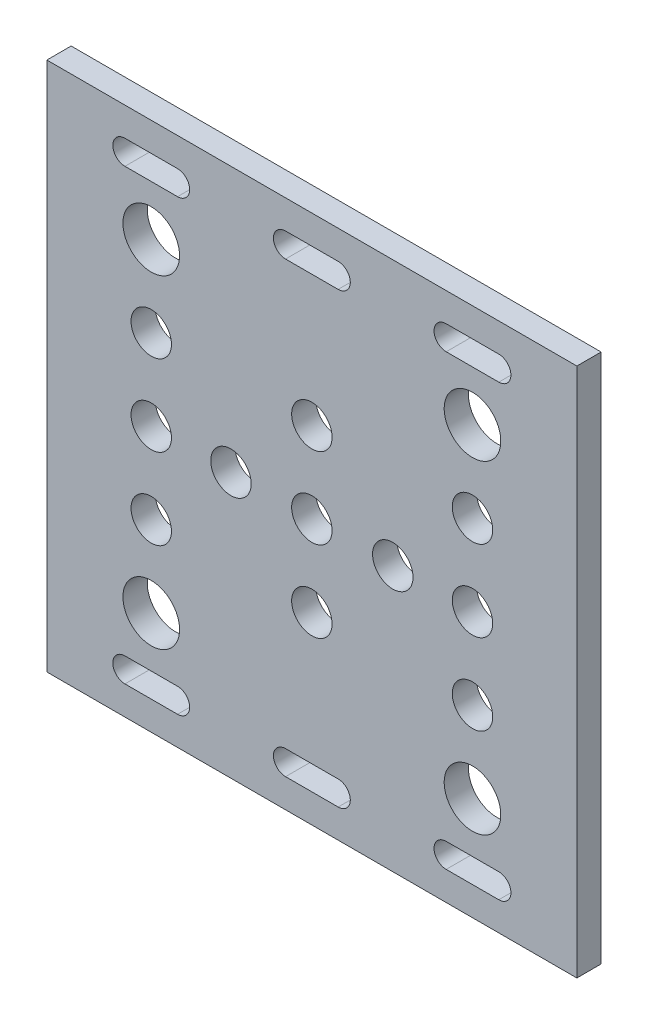
from build123d import *

# Parameters (mm, degrees)
SKETCH1_W           = 65.5
SKETCH1_H           = 65.5
SKETCH1_R           = 3.5
SKETCH1_R_2         = 2.5
BOSS_EXTRUDE1_DEPTH = 3


with BuildPart() as part:
    # Sketch1 → Boss-Extrude1 (new body)
    with BuildSketch(Plane.XY):
        Rectangle(SKETCH1_W, SKETCH1_H)
        with Locations((-19.85, 20)):
            Circle(SKETCH1_R, mode=Mode.SUBTRACT)
        with Locations((-19.85, 10)):
            Circle(SKETCH1_R_2, mode=Mode.SUBTRACT)
        with Locations((-19.85, 0)):
            Circle(SKETCH1_R_2, mode=Mode.SUBTRACT)
        with Locations((-19.85, -10)):
            Circle(SKETCH1_R_2, mode=Mode.SUBTRACT)
        with Locations((-19.85, -20)):
            Circle(SKETCH1_R, mode=Mode.SUBTRACT)
        with Locations((19.85, -20)):
            Circle(SKETCH1_R, mode=Mode.SUBTRACT)
        with Locations((19.85, -10)):
            Circle(SKETCH1_R_2, mode=Mode.SUBTRACT)
        with Locations((19.85, 0)):
            Circle(SKETCH1_R_2, mode=Mode.SUBTRACT)
        with Locations((19.85, 10)):
            Circle(SKETCH1_R_2, mode=Mode.SUBTRACT)
        with Locations((19.85, 20)):
            Circle(SKETCH1_R, mode=Mode.SUBTRACT)
        Circle(SKETCH1_R_2, mode=Mode.SUBTRACT)
        with Locations((10, 0)):
            Circle(SKETCH1_R_2, mode=Mode.SUBTRACT)
        with Locations((-10, 0)):
            Circle(SKETCH1_R_2, mode=Mode.SUBTRACT)
        with Locations((0, 10)):
            Circle(SKETCH1_R_2, mode=Mode.SUBTRACT)
        with Locations((0, -10)):
            Circle(SKETCH1_R_2, mode=Mode.SUBTRACT)
        with BuildLine():
            Line((-23.1, 29.2), (-16.6, 29.2))
            ThreePointArc((-16.6, 29.2), (-15.1, 27.7), (-16.6, 26.2))
            Line((-16.6, 26.2), (-23.1, 26.2))
            ThreePointArc((-23.1, 26.2), (-24.6, 27.7), (-23.1, 29.2))
        make_face(mode=Mode.SUBTRACT)
        with BuildLine():
            Line((-23.1, -26.2), (-16.6, -26.2))
            ThreePointArc((-16.6, -26.2), (-15.1, -27.7), (-16.6, -29.2))
            Line((-16.6, -29.2), (-23.1, -29.2))
            ThreePointArc((-23.1, -29.2), (-24.6, -27.7), (-23.1, -26.2))
        make_face(mode=Mode.SUBTRACT)
        with BuildLine():
            Line((-3.25, 29.2), (3.25, 29.2))
            ThreePointArc((3.25, 29.2), (4.75, 27.7), (3.25, 26.2))
            Line((3.25, 26.2), (-3.25, 26.2))
            ThreePointArc((-3.25, 26.2), (-4.75, 27.7), (-3.25, 29.2))
        make_face(mode=Mode.SUBTRACT)
        with BuildLine():
            Line((-3.25, -29.2), (3.25, -29.2))
            ThreePointArc((3.25, -29.2), (4.75, -27.7), (3.25, -26.2))
            Line((3.25, -26.2), (-3.25, -26.2))
            ThreePointArc((-3.25, -26.2), (-4.75, -27.7), (-3.25, -29.2))
        make_face(mode=Mode.SUBTRACT)
        with BuildLine():
            Line((23.1, -26.2), (16.6, -26.2))
            ThreePointArc((16.6, -26.2), (15.1, -27.7), (16.6, -29.2))
            Line((16.6, -29.2), (23.1, -29.2))
            ThreePointArc((23.1, -29.2), (24.6, -27.7), (23.1, -26.2))
        make_face(mode=Mode.SUBTRACT)
        with BuildLine():
            Line((23.1, 29.2), (16.6, 29.2))
            ThreePointArc((16.6, 29.2), (15.1, 27.7), (16.6, 26.2))
            Line((16.6, 26.2), (23.1, 26.2))
            ThreePointArc((23.1, 26.2), (24.6, 27.7), (23.1, 29.2))
        make_face(mode=Mode.SUBTRACT)
    extrude(amount=BOSS_EXTRUDE1_DEPTH)


solid = part.part
